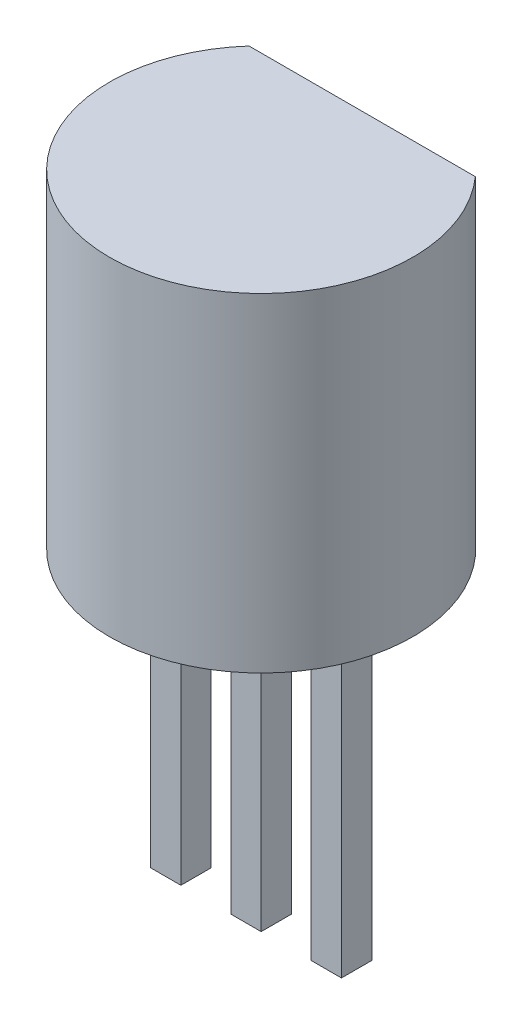
from build123d import *

# Parameters (mm, degrees)
BOSS_EXTRUDE1_DEPTH = 5.2
SKETCH2_W           = 0.48
SKETCH2_H           = 0.48
BOSS_EXTRUDE2_DEPTH = 5
LPATTERN1_COUNT     = 2
LPATTERN1_PITCH     = 1.27
LPATTERN1_COL_COUNT = 2
LPATTERN1_COL_PITCH = 1.27


with BuildPart() as part:
    # Sketch1 → Boss-Extrude1 (new body)
    with BuildSketch(Plane(origin=(0, 0, 0), x_dir=(1, 0, 0), z_dir=(0, 1, 0))):
        with BuildLine():
            Line((-1.79, 1.598718237), (1.79, 1.598718237))
            ThreePointArc((1.79, 1.598718237), (0, -2.4), (-1.79, 1.598718237))
        make_face()
    extrude(amount=BOSS_EXTRUDE1_DEPTH)

    # Sketch2 → Boss-Extrude2 (add)
    with BuildSketch(Plane.XZ):
        Rectangle(SKETCH2_W, SKETCH2_H)
    boss_extrude2 = extrude(amount=BOSS_EXTRUDE2_DEPTH)

    # LPattern1: Boss-Extrude2 ×2
    with Locations(*[(i * LPATTERN1_PITCH, 0, 0) for i in range(1, LPATTERN1_COUNT)]):
        add(boss_extrude2)

    # LPattern1 col: Boss-Extrude2 ×2
    with Locations(*[(-i * LPATTERN1_COL_PITCH, 0, 0) for i in range(1, LPATTERN1_COL_COUNT)]):
        add(boss_extrude2)


solid = part.part
